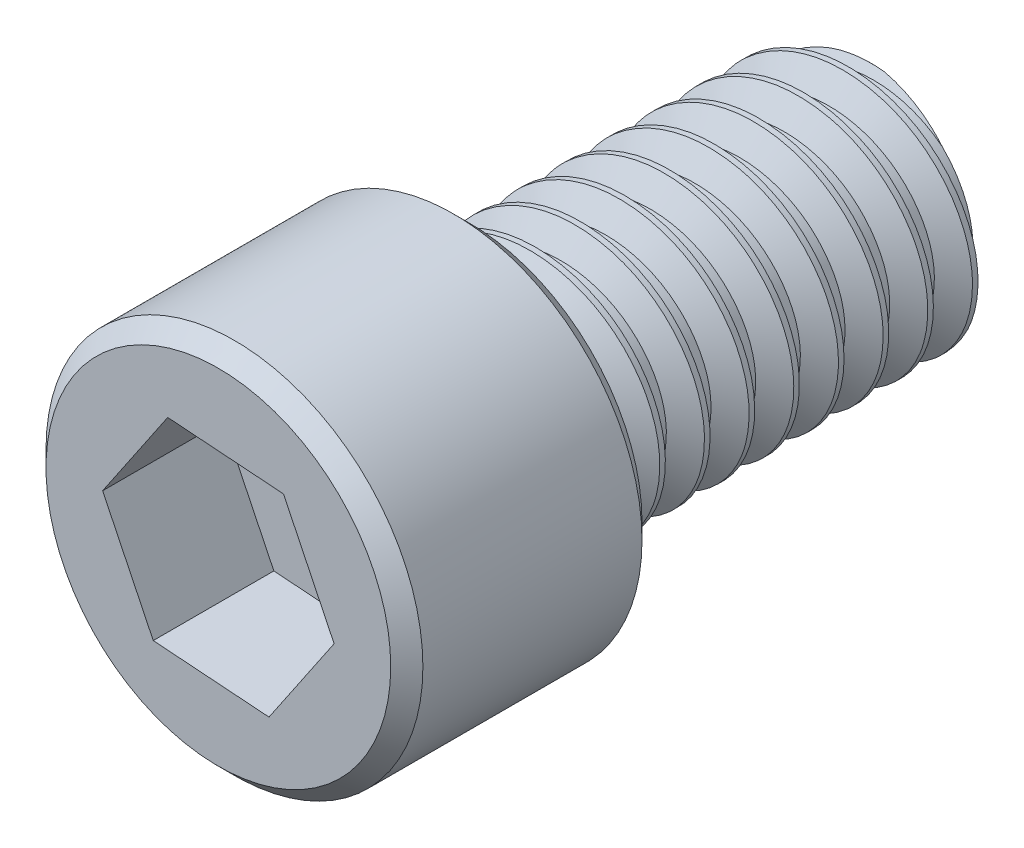
from build123d import *

# Parameters (mm, degrees)
SKETCH1_R           = 5.953125
BOSS_EXTRUDE1_DEPTH = 7.9375
SKETCH3_R           = 3.96875
BOSS_EXTRUDE2_DEPTH = 12.7
CHAMFER1_SIZE       = 0.508
THREAD1_PITCH       = 1.411111111
CUT_EXTRUDE1_DEPTH  = 3.81


with BuildPart() as part:
    # Sketch1 → Boss-Extrude1 (new body)
    with BuildSketch(Plane.XY):
        Circle(SKETCH1_R)
    extrude(amount=BOSS_EXTRUDE1_DEPTH)

    # Sketch3 → Boss-Extrude2 (add)
    with BuildSketch(Plane(origin=(0, 0, 0), x_dir=(-1, 0, 0), z_dir=(0, 0, -1))):
        with Locations(Location((0, 0, 0), (0, 0, 180))):
            Circle(SKETCH3_R)
    extrude(amount=BOSS_EXTRUDE2_DEPTH)

    # Chamfer1
    chamfer1_edges = [part.edges().sort_by_distance(p)[0] for p in [
        (-5.953125, 0, 0),
        (-5.953125, 0, 7.9375),
        (-3.96875, 0, -12.7),
    ]]
    chamfer(chamfer1_edges, length=CHAMFER1_SIZE)

    # Thread1: arcs per turn and ends read off the stored shape
    # Thread1: the profile of Thread Profile1 profile screwed along a right-hand helix through 10.8 turns, 8 arcs to a turn; built about Z, then put on its axis
    thread1_z = Axis((0, 0, 0), (0, 0, 1))
    thread1_corners = [(3.96905, 0, -0.000173205), (3.96905, 0, 1.234895423), (3.20496371, 0, 0.793749998), (3.20496371, 0, 0.44097222)]
    with BuildLine(mode=Mode.PRIVATE) as thread1_profile:
        Line(thread1_corners[0], thread1_corners[1])
        Line(thread1_corners[1], thread1_corners[2])
        Line(thread1_corners[2], thread1_corners[3])
        Line(thread1_corners[3], thread1_corners[0])
    thread1_cap = Face(thread1_profile.wire())
    thread1_turn_angles = [0, 22.5, 45, 67.5, 90, 112.5, 135, 157.5, 180, 202.5, 225, 247.5, 270, 292.5, 315, 337.5, 360]
    thread1_turn_weights = [1, 0.9238795325112867, 1, 0.9238795325112867, 1, 0.9238795325112867, 1, 0.9238795325112867, 1, 0.9238795325112867, 1, 0.9238795325112867, 1, 0.9238795325112867, 1, 0.9238795325112867, 1]
    thread1_turn_rails = [Edge.make_bspline([Vector(p[0], p[1], 0).rotate(thread1_z, thread1_turn_angles[k]) / thread1_turn_weights[k] + Vector(0, 0, p[2] + THREAD1_PITCH * thread1_turn_angles[k] / 360) for k in range(17)], [0, 0, 0, 1, 1, 2, 2, 3, 3, 4, 4, 5, 5, 6, 6, 7, 7, 8, 8, 8], 2, thread1_turn_weights) for p in thread1_corners]
    thread1_turn_sides = [Face.make_surface_from_curves(thread1_turn_rails[p[0]], thread1_turn_rails[p[1]]) for p in [(0, 1), (1, 2), (2, 3), (3, 0)]]
    thread1_last_angles = [3600, 3622.5, 3645, 3667.5, 3690, 3712.5, 3735, 3757.5, 3780, 3802.5, 3825, 3847.5, 3870, 3879, 3888]
    thread1_last_weights = [1, 0.9238795325112867, 1, 0.9238795325112867, 1, 0.9238795325112867, 1, 0.9238795325112867, 1, 0.9238795325112867, 1, 0.9238795325112867, 1, 0.9876883405951378, 1]
    thread1_last_rails = [Edge.make_bspline([Vector(p[0], p[1], 0).rotate(thread1_z, thread1_last_angles[k]) / thread1_last_weights[k] + Vector(0, 0, p[2] + THREAD1_PITCH * thread1_last_angles[k] / 360) for k in range(15)], [0, 0, 0, 1, 1, 2, 2, 3, 3, 4, 4, 5, 5, 6, 6, 7, 7, 7], 2, thread1_last_weights) for p in thread1_corners]
    thread1_last_sides = [Face.make_surface_from_curves(thread1_last_rails[p[0]], thread1_last_rails[p[1]]) for p in [(0, 1), (1, 2), (2, 3), (3, 0)]]
    thread1 = Plane(origin=(0, 0, -14.732), x_dir=(1, 0, 0), z_dir=(0, 0, 1)) * Solid(Shell([*[p.moved(Location((0, 0, THREAD1_PITCH * i))) for i in range(10) for p in thread1_turn_sides], *thread1_last_sides, thread1_cap, thread1_cap.rotate(thread1_z, 3888).moved(Location((0, 0, THREAD1_PITCH * 3888 / 360)))]))
    add(thread1, mode=Mode.SUBTRACT)

    # Sketch4 → Cut-Extrude1 (cut)
    with BuildSketch(Plane.XY.offset(7.9375)):
        Polygon((-2.057224737, -3.034577353), (1.599408709, -3.29889756), (3.656633446, -0.264320207), (2.057224737, 3.034577353), (-1.599408709, 3.29889756), (-3.656633446, 0.264320207), align=None)
    extrude(amount=-CUT_EXTRUDE1_DEPTH, mode=Mode.SUBTRACT)


solid = part.part
